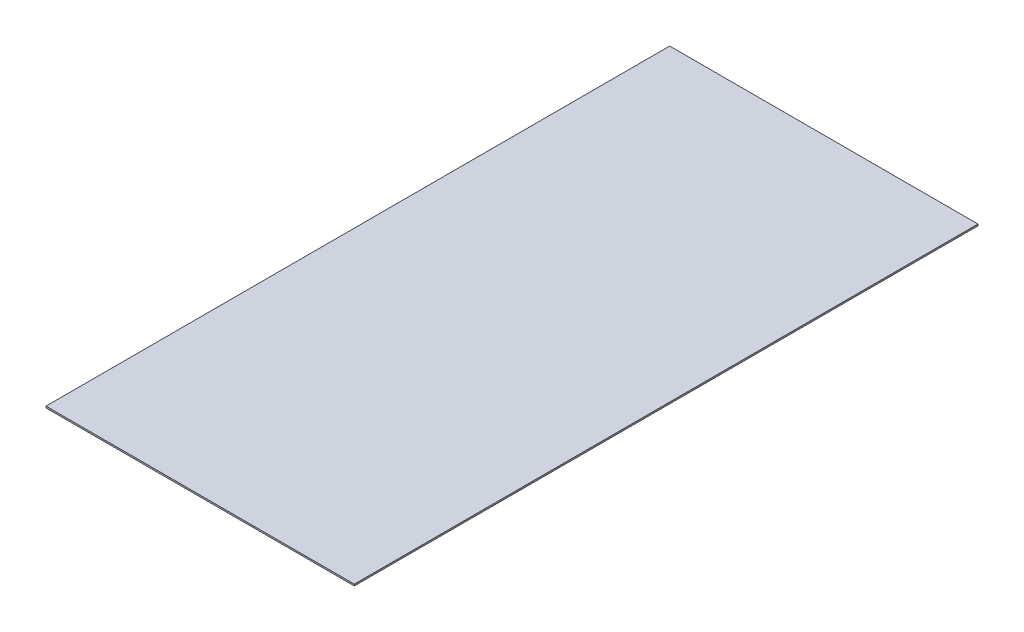
from build123d import *

# Parameters (mm, degrees)
SKETCH1_W           = 35
SKETCH1_H           = 70.8
BOSS_EXTRUDE1_DEPTH = 0.18


with BuildPart() as part:
    # Sketch1 → Boss-Extrude1 (new body)
    with BuildSketch(Plane(origin=(0, 0, 0), x_dir=(1, 0, 0), z_dir=(0, 1, 0))):
        Rectangle(SKETCH1_W, SKETCH1_H)
    extrude(amount=BOSS_EXTRUDE1_DEPTH)


solid = part.part
